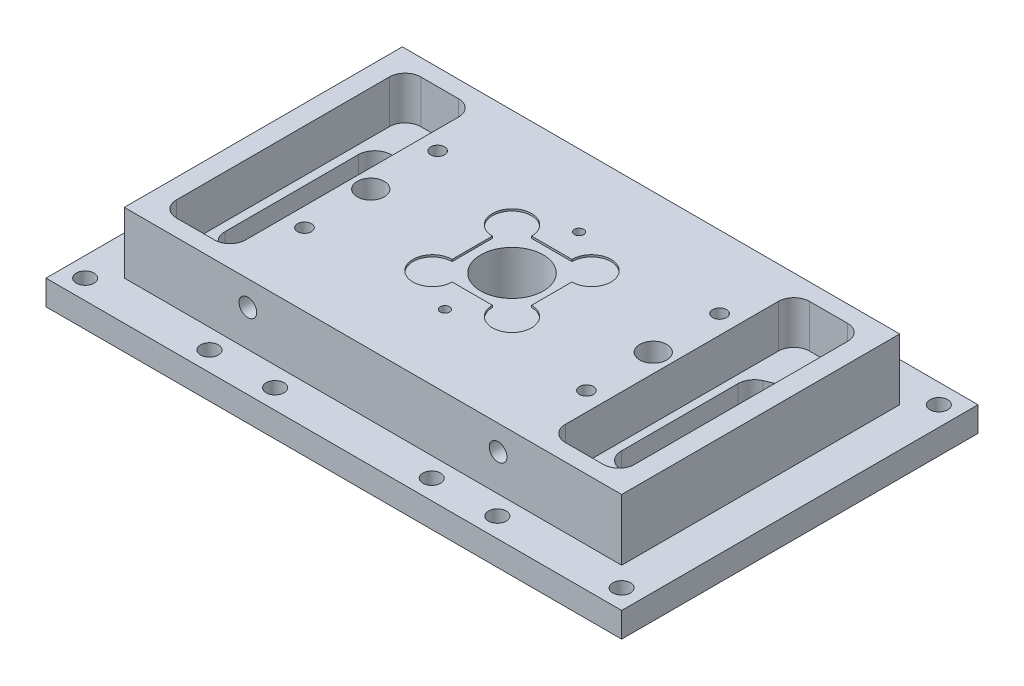
from build123d import *

# Parameters (mm, degrees)
MAIN_SKETCH_W                           = 73.5
MAIN_SKETCH_H                           = 45.5
MAIN_SKETCH_W_2                         = 63.5
MAIN_SKETCH_H_2                         = 35.5
LIP_DEPTH                               = 3.175
MOUNTING_BASE_OUTLINE_W                 = 63.5
MOUNTING_BASE_OUTLINE_H                 = 35.5
MOUNTING_BASE_OUTLINE_R                 = 1.7272
MOUNTING_BASE_OUTLINE_R_2               = 4
MOUNTING_BASE_DEPTH                     = 11
HEATER_CART_4_40_TAPS_D                 = 2.2606
HEATER_CART_4_40_TAPS_DEPTH             = 7.595
HEATER_CART_4_40_TAPS_TIP               = 0.679152758
HEATER_CART_4_40_TAPS_ON_FACE_2_D       = 2.2606
HEATER_CART_4_40_TAPS_ON_FACE_2_DEPTH   = 7.595
HEATER_CART_4_40_TAPS_ON_FACE_2_TIP     = 0.679152758
MAIN_SKETCH_12_W                        = 8.85
MAIN_SKETCH_12_H                        = 31.2
BOTTOM_SQUARE_CUTOUT_DEPTH              = 2
SQUARE_MICRO_D_CUTOUT_START             = 5.5
SQUARE_MICRO_D_CUTOUT_OUTLINE_W         = 8.85
SQUARE_MICRO_D_CUTOUT_OUTLINE_H         = 31.2
SQUARE_MICRO_D_CUTOUT_DEPTH             = 5.5
MAIN_SKETCH_7_R                         = 0.285
ROUND_MICRO_D_CUTOUT_DEPTH              = 11
INTERNAL_CORNER_CUTOUTS_FILLET_R        = 2
CHIP_CLAMP_0_80_TAPS_AT_2_COUNT         = 2
CHIP_CLAMP_0_80_TAPS_AT_2_PITCH         = 17.1232
CHIP_CLAMP_0_80_TAPS_AT_3_COUNT         = 2
CHIP_CLAMP_0_80_TAPS_AT_3_PITCH         = 17.1232
CHIP_POCKET_START                       = 10.75
MAIN_SKETCH_6_R                         = 2.5
MAIN_SKETCH_6_W                         = 10.15
MAIN_SKETCH_6_H                         = 10.15
CHIP_POCKET_DEPTH                       = 0.25
F_2_56_CLOSE_CLEAR_43_0_089_D           = 2.2606
F_2_56_CLOSE_CLEAR_43_0_089_ON_FACE_2_D = 2.2606
PCB_2_56_TAPS_D                         = 1.778
PCB_2_56_TAPS_DEPTH                     = 5.734
PCB_2_56_TAPS_TIP                       = 0.53416509
BOTTOM_COVER_2_56_TAPS_D                = 1.778
BOTTOM_COVER_2_56_TAPS_DEPTH            = 5.734
BOTTOM_COVER_2_56_TAPS_TIP              = 0.53416509
F_2_56_TAPPED_HOLE1_D                   = 1.778
F_2_56_TAPPED_HOLE1_DEPTH               = 5.734
F_2_56_TAPPED_HOLE1_TIP                 = 0.53416509


# Read off the part's stored shape, not the designer's step: Mounting_Base, Square_Micro_D_Cutout
with BuildPart() as part:
    # Main_Sketch → Lip (new body)
    with BuildSketch(Plane(origin=(0, 0, 0), x_dir=(1, 0, 0), z_dir=(0, 1, 0))):
        with Locations((36.75, -22.75)):
            Rectangle(MAIN_SKETCH_W, MAIN_SKETCH_H)
        with Locations((36.75, -22.75)):
            Rectangle(MAIN_SKETCH_W_2, MAIN_SKETCH_H_2, mode=Mode.SUBTRACT)
    extrude(amount=LIP_DEPTH)

    # Mounting_Base outline → Mounting_Base (add)
    with BuildSketch(Plane(origin=(0, 0, 0), x_dir=(1, 0, 0), z_dir=(0, 1, 0))):
        with Locations((36.75, -22.75)):
            Rectangle(MOUNTING_BASE_OUTLINE_W, MOUNTING_BASE_OUTLINE_H)
        with Locations((18.716, -22.75)):
            Circle(MOUNTING_BASE_OUTLINE_R, mode=Mode.SUBTRACT)
        with Locations((36.75, -22.75)):
            Circle(MOUNTING_BASE_OUTLINE_R_2, mode=Mode.SUBTRACT)
        with Locations((54.784, -22.75)):
            Circle(MOUNTING_BASE_OUTLINE_R, mode=Mode.SUBTRACT)
    extrude(amount=MOUNTING_BASE_DEPTH)

    # Heater_Cart_#4-40_Taps
    with Locations(Plane(origin=(52.725, 7.825, 5), x_dir=(-1, 0, 0), z_dir=(0, 0, -1))):
        with Locations((0, 0), (31.95, 0)):
            Hole(HEATER_CART_4_40_TAPS_D / 2, depth=HEATER_CART_4_40_TAPS_DEPTH)
            with Locations((0, 0, -(HEATER_CART_4_40_TAPS_DEPTH + HEATER_CART_4_40_TAPS_TIP / 2))):  # 118° drill point
                Cone(0, HEATER_CART_4_40_TAPS_D / 2, HEATER_CART_4_40_TAPS_TIP, mode=Mode.SUBTRACT)

    # Heater_Cart_#4-40_Taps on face 2
    with Locations(Plane(origin=(20.775, 7.825, 40.5), x_dir=(1, 0, 0), z_dir=(0, 0, 1))):
        with Locations((0, 0), (31.95, 0)):
            Hole(HEATER_CART_4_40_TAPS_ON_FACE_2_D / 2, depth=HEATER_CART_4_40_TAPS_ON_FACE_2_DEPTH)
            with Locations((0, 0, -(HEATER_CART_4_40_TAPS_ON_FACE_2_DEPTH + HEATER_CART_4_40_TAPS_ON_FACE_2_TIP / 2))):  # 118° drill point
                Cone(0, HEATER_CART_4_40_TAPS_ON_FACE_2_D / 2, HEATER_CART_4_40_TAPS_ON_FACE_2_TIP, mode=Mode.SUBTRACT)

    # Main_Sketch<12> → Bottom_square_cutout (cut)
    with BuildSketch(Plane(origin=(0, 0, 0), x_dir=(1, 0, 0), z_dir=(0, 1, 0))):
        with Locations((11.925, -22.75)):
            Rectangle(MAIN_SKETCH_12_W, MAIN_SKETCH_12_H)
        with BuildLine():
            ThreePointArc((11.521574965, -33.196222286), (10.496212222, -33.351578951), (9.521946869, -32.996175702))
            ThreePointArc((9.521946869, -32.996175702), (8.851632057, -32.244424217), (8.609546604, -31.26675))
            Line((8.609546604, -31.26675), (8.609546604, -14.23325))
            ThreePointArc((8.609546604, -14.23325), (8.851632057, -13.255575783), (9.521946869, -12.503824298))
            ThreePointArc((9.521946869, -12.503824298), (10.496212222, -12.148421049), (11.521574965, -12.303777714))
            Line((11.521574965, -12.303777714), (14.054010046, -13.37581902))
            ThreePointArc((14.054010046, -13.37581902), (14.983840891, -14.148001292), (15.3324534, -15.305291306))
            Line((15.3324534, -15.305291306), (15.3324534, -30.194708694))
            ThreePointArc((15.3324534, -30.194708694), (14.983840891, -31.351998708), (14.054010046, -32.12418098))
            Line((14.054010046, -32.12418098), (11.521574965, -33.196222286))
        make_face(mode=Mode.SUBTRACT)
    bottom_square_cutout = extrude(amount=BOTTOM_SQUARE_CUTOUT_DEPTH, mode=Mode.SUBTRACT)

    # Square_Micro_D_Cutout outline → Square_Micro_D_Cutout (cut)
    with BuildSketch(Plane(origin=(0, 0, 0), x_dir=(1, 0, 0), z_dir=(0, 1, 0)).offset(SQUARE_MICRO_D_CUTOUT_START)):
        with Locations((11.925, -22.75)):
            Rectangle(SQUARE_MICRO_D_CUTOUT_OUTLINE_W, SQUARE_MICRO_D_CUTOUT_OUTLINE_H)
        with BuildLine():
            ThreePointArc((11.521574965, -33.196222286), (9.547492447, -33.013373348), (8.609546604, -31.26675))
            Line((8.609546604, -31.26675), (8.609546604, -14.23325))
            ThreePointArc((8.609546604, -14.23325), (9.547492447, -12.486626652), (11.521574965, -12.303777714))
            Line((11.521574965, -12.303777714), (14.054010046, -13.37581902))
            ThreePointArc((14.054010046, -13.37581902), (14.983840891, -14.148001291), (15.3324534, -15.305291306))
            Line((15.3324534, -15.305291306), (15.3324534, -30.194708694))
            ThreePointArc((15.3324534, -30.194708694), (14.983840891, -31.351998709), (14.054010046, -32.12418098))
            Line((14.054010046, -32.12418098), (11.521574965, -33.196222286))
        make_face(mode=Mode.SUBTRACT)
    square_micro_d_cutout = extrude(amount=SQUARE_MICRO_D_CUTOUT_DEPTH, mode=Mode.SUBTRACT)

    # Main_Sketch<7> → Round_Micro_D_Cutout (cut)
    # profile 1 of 2: a face of its own
    with BuildSketch(Plane(origin=(0, 0, 0), x_dir=(1, 0, 0), z_dir=(0, 1, 0))):
        with BuildLine():
            ThreePointArc((9.521946869, -32.996175702), (8.851632057, -32.244424217), (8.609546604, -31.26675))
            Line((8.609546604, -31.26675), (8.609546604, -14.23325))
            ThreePointArc((8.609546604, -14.23325), (8.851632057, -13.255575783), (9.521946869, -12.503824298))
            ThreePointArc((9.521946869, -12.503824298), (10.496212222, -12.148421049), (11.521574965, -12.303777714))
            Line((11.521574965, -12.303777714), (14.054010046, -13.37581902))
            ThreePointArc((14.054010046, -13.37581902), (14.983840891, -14.148001292), (15.3324534, -15.305291306))
            Line((15.3324534, -15.305291306), (15.3324534, -30.194708694))
            ThreePointArc((15.3324534, -30.194708694), (14.983840891, -31.351998708), (14.054010046, -32.12418098))
            Line((14.054010046, -32.12418098), (11.521574965, -33.196222286))
            ThreePointArc((11.521574965, -33.196222286), (10.496212222, -33.351578951), (9.521946869, -32.996175702))
        make_face()
        with Locations((11.399546604, -22.75)):
            Circle(MAIN_SKETCH_7_R, mode=Mode.SUBTRACT)
    # profile 2 of 2: a face of its own
    with BuildSketch(Plane(origin=(0, 0, 0), x_dir=(1, 0, 0), z_dir=(0, 1, 0))):
        with Locations((11.399546604, -22.75)):
            Circle(MAIN_SKETCH_7_R)
    round_micro_d_cutout = extrude(amount=ROUND_MICRO_D_CUTOUT_DEPTH, mode=Mode.SUBTRACT)

    # MicroD_Mirror: Bottom_square_cutout, Square_Micro_D_Cutout, Round_Micro_D_Cutout across plane
    add(bottom_square_cutout.mirror(Plane(origin=(36.75, 0, 0), x_dir=(0, 0, 1), z_dir=(1, 0, 0))), mode=Mode.SUBTRACT)
    add(square_micro_d_cutout.mirror(Plane(origin=(36.75, 0, 0), x_dir=(0, 0, 1), z_dir=(1, 0, 0))), mode=Mode.SUBTRACT)
    add(round_micro_d_cutout.mirror(Plane(origin=(36.75, 0, 0), x_dir=(0, 0, 1), z_dir=(1, 0, 0))), mode=Mode.SUBTRACT)

    # Internal_Corner_cutouts_fillet
    internal_corner_cutouts_fillet_edges = [part.edges().sort_by_distance(p)[0] for p in [
        (16.35, 8.25, 38.35),
        (7.5, 8.25, 38.35),
        (7.5, 8.25, 7.15),
        (16.35, 8.25, 7.15),
        (57.15, 1, 7.15),
        (57.15, 1, 38.35),
        (66, 1, 38.35),
        (66, 1, 7.15),
        (66, 8.25, 7.15),
        (66, 8.25, 38.35),
        (57.15, 8.25, 38.35),
        (57.15, 8.25, 7.15),
        (16.35, 1, 38.35),
        (16.35, 1, 7.15),
        (7.5, 1, 7.15),
        (7.5, 1, 38.35),
    ]]
    fillet(internal_corner_cutouts_fillet_edges, radius=INTERNAL_CORNER_CUTOUTS_FILLET_R)

    # Sketch3 → Chip_Clamp_#0-80 Taps (revolve, cut)
    with BuildSketch(Plane(origin=(36.75, 11, 31.3116), x_dir=(0, 0, 1), z_dir=(1, 0, 0))):
        Polygon((0, 0), (0, 4.358890611), (0.59563, 4.001), (0.59563, 0), align=None)
    chip_clamp_0_80_taps = revolve(axis=Axis((36.75, 17.35, 31.3116), (0, -1, 0)), mode=Mode.SUBTRACT)

    # Chip_Clamp_#0-80 Taps at 2: Chip_Clamp_#0-80 Taps ×2
    with Locations(*[(0, 0, -i * CHIP_CLAMP_0_80_TAPS_AT_2_PITCH) for i in range(1, CHIP_CLAMP_0_80_TAPS_AT_2_COUNT)]):
        add(chip_clamp_0_80_taps, mode=Mode.SUBTRACT)

    # Chip_Clamp_#0-80 Taps at 3: Chip_Clamp_#0-80 Taps ×2
    with Locations(*[(0, 0, -i * CHIP_CLAMP_0_80_TAPS_AT_3_PITCH) for i in range(1, CHIP_CLAMP_0_80_TAPS_AT_3_COUNT)]):
        add(chip_clamp_0_80_taps, mode=Mode.SUBTRACT)

    # Main_Sketch<6> → Chip_Pocket (cut)
    with BuildSketch(Plane(origin=(0, 0, 0), x_dir=(1, 0, 0), z_dir=(0, 1, 0)).offset(CHIP_POCKET_START)):
        with BuildLine():
            Line((31.675, -20.175), (31.675, -17.675))
            Line((31.675, -17.675), (34.175, -17.675))
            ThreePointArc((34.175, -17.675), (29.907233047, -15.907233047), (31.675, -20.175))
        make_face()
        with BuildLine():
            Line((34.175, -17.675), (31.675, -17.675))
            Line((31.675, -17.675), (31.675, -20.175))
            ThreePointArc((31.675, -20.175), (33.442766953, -19.442766953), (34.175, -17.675))
        make_face()
        with BuildLine():
            ThreePointArc((44.325, -17.675), (41.825, -15.175), (39.325, -17.675))
            Line((39.325, -17.675), (41.825, -17.675))
            Line((41.825, -17.675), (41.825, -20.175))
            ThreePointArc((41.825, -20.175), (43.592766953, -19.442766953), (44.325, -17.675))
        make_face()
        with BuildLine():
            Line((41.825, -17.675), (39.325, -17.675))
            ThreePointArc((39.325, -17.675), (40.057233047, -19.442766953), (41.825, -20.175))
            Line((41.825, -20.175), (41.825, -17.675))
        make_face()
        with BuildLine():
            ThreePointArc((34.175, -27.825), (33.442766953, -26.057233047), (31.675, -25.325))
            Line((31.675, -25.325), (31.675, -27.825))
            Line((31.675, -27.825), (34.175, -27.825))
        make_face()
        with BuildLine():
            Line((31.675, -27.825), (31.675, -25.325))
            ThreePointArc((31.675, -25.325), (29.907233047, -29.592766953), (34.175, -27.825))
            Line((34.175, -27.825), (31.675, -27.825))
        make_face()
        with BuildLine():
            ThreePointArc((44.325, -27.825), (43.592766953, -26.057233047), (41.825, -25.325))
            Line((41.825, -25.325), (41.825, -27.825))
            Line((41.825, -27.825), (39.325, -27.825))
            ThreePointArc((39.325, -27.825), (41.825, -30.325), (44.325, -27.825))
        make_face()
        with BuildLine():
            Line((41.825, -27.825), (41.825, -25.325))
            ThreePointArc((41.825, -25.325), (40.057233047, -26.057233047), (39.325, -27.825))
            Line((39.325, -27.825), (41.825, -27.825))
        make_face()
        with Locations((41.825, -27.825)):
            Circle(MAIN_SKETCH_6_R)
        with Locations((41.825, -17.675)):
            Circle(MAIN_SKETCH_6_R)
        with Locations((31.675, -17.675)):
            Circle(MAIN_SKETCH_6_R)
        with Locations((31.675, -27.825)):
            Circle(MAIN_SKETCH_6_R)
        with Locations((36.75, -22.75)):
            Rectangle(MAIN_SKETCH_6_W, MAIN_SKETCH_6_H)
    extrude(amount=CHIP_POCKET_DEPTH, mode=Mode.SUBTRACT)

    # 2-56_Close_Clear#43 (0.089) (through all)
    with Locations(Plane(origin=(2.5, 3.175, 2.5), x_dir=(0, 0, 1), z_dir=(0, 1, 0))):
        with Locations((0, 0), (40.5, 24.25), (0, 68.5), (0, 44.25), (40.5, 68.5), (40.5, 44.25), (40.5, 0), (0, 24.25)):
            Hole(F_2_56_CLOSE_CLEAR_43_0_089_D / 2)

    # 2-56_Close_Clear#43 (0.089) on face 2 (through all)
    with Locations(Plane(origin=(26.75, 0, 43), x_dir=(0, 0, -1), z_dir=(0, -1, 0))):
        with Locations((0, 0), (40.5, 44.25), (40.5, 20), (0, 44.25), (0, 20), (0, -24.25), (40.5, 0), (40.5, -8.375), (40.5, 28.375), (0, 28.375), (0, -8.375)):
            Hole(F_2_56_CLOSE_CLEAR_43_0_089_ON_FACE_2_D / 2)

    # PCB #2-56 Taps
    with Locations(Plane(origin=(18.75, 11, 14.25), x_dir=(0, 0, 1), z_dir=(0, 1, 0))):
        with Locations((0, 0), (17, 0), (0, 36), (17, 36)):
            Hole(PCB_2_56_TAPS_D / 2, depth=PCB_2_56_TAPS_DEPTH)
            with Locations((0, 0, -(PCB_2_56_TAPS_DEPTH + PCB_2_56_TAPS_TIP / 2))):  # 118° drill point
                Cone(0, PCB_2_56_TAPS_D / 2, PCB_2_56_TAPS_TIP, mode=Mode.SUBTRACT)

    # Bottom_Cover#2-56 Taps
    with Locations(Plane(origin=(54.785, 0, 18.750000125), x_dir=(0, 0, -1), z_dir=(0, -1, 0))):
        with Locations((0, 0), (-8, 0), (-8, -36.07), (0, -36.07)):
            Hole(BOTTOM_COVER_2_56_TAPS_D / 2, depth=BOTTOM_COVER_2_56_TAPS_DEPTH)
            with Locations((0, 0, -(BOTTOM_COVER_2_56_TAPS_DEPTH + BOTTOM_COVER_2_56_TAPS_TIP / 2))):  # 118° drill point
                Cone(0, BOTTOM_COVER_2_56_TAPS_D / 2, BOTTOM_COVER_2_56_TAPS_TIP, mode=Mode.SUBTRACT)

    # #2-56 Tapped Hole1
    with Locations(Plane(origin=(32.94, 0, 31.38), x_dir=(0, 0, -1), z_dir=(0, -1, 0))):
        with Locations((0, 0), (-7.62, 0), (-7.62, 7.62), (0, 7.62)):
            Hole(F_2_56_TAPPED_HOLE1_D / 2, depth=F_2_56_TAPPED_HOLE1_DEPTH)
            with Locations((0, 0, -(F_2_56_TAPPED_HOLE1_DEPTH + F_2_56_TAPPED_HOLE1_TIP / 2))):  # 118° drill point
                Cone(0, F_2_56_TAPPED_HOLE1_D / 2, F_2_56_TAPPED_HOLE1_TIP, mode=Mode.SUBTRACT)


solid = part.part
